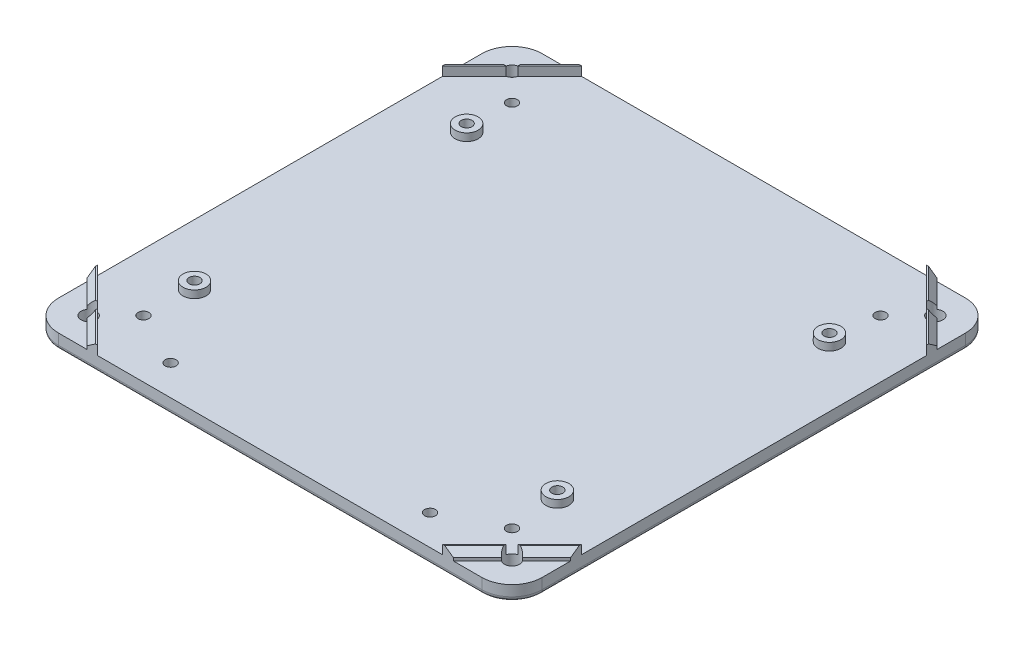
from build123d import *
from build123d.topology import SkipClean

# Parameters (mm, degrees)
SKETCH1_W           = 203.2
SKETCH1_H           = 203.2
BOSS_EXTRUDE1_DEPTH = 6.35
FILLET1_R           = 12.7
SKETCH2_R           = 3.175
CUT_EXTRUDE1_DEPTH  = 288.438345563
FILLET2_R           = 1.905
SKETCH3_R           = 2.286
CUT_EXTRUDE2_DEPTH  = 288.438345563
SKETCH4_R           = 2.286
CUT_EXTRUDE3_DEPTH  = 288.438345563
SKETCH5_R           = 4.826
SKETCH5_R_2         = 2.286
BOSS_EXTRUDE2_DEPTH = 3.175
BOSS_EXTRUDE3_DEPTH = 3.81
CHAMFER1_SIZE       = 2.54


with BuildPart() as part:
    # Sketch1 → Boss-Extrude1 (new body)
    with BuildSketch(Plane(origin=(0, 0, 0), x_dir=(1, 0, 0), z_dir=(0, 1, 0))):
        with Locations((101.6, 101.6)):
            Rectangle(SKETCH1_W, SKETCH1_H)
    extrude(amount=BOSS_EXTRUDE1_DEPTH)

    # Fillet1
    fillet1_edges = [part.edges().sort_by_distance(p)[0] for p in [
        (0, 3.175, -203.2),
        (0, 3.175, 0),
        (203.2, 3.175, 0),
        (203.2, 3.175, -203.2),
    ]]
    fillet(fillet1_edges, radius=FILLET1_R)

    # Sketch2 → Cut-Extrude1 (cut, through all)
    with BuildSketch(Plane.XZ):
        with Locations((12.7, -12.7)):
            Circle(SKETCH2_R)
        with Locations((190.5, -12.7)):
            Circle(SKETCH2_R)
        with Locations((190.5, -190.5)):
            Circle(SKETCH2_R)
        with Locations((12.7, -190.5)):
            Circle(SKETCH2_R)
    extrude(amount=-CUT_EXTRUDE1_DEPTH, mode=Mode.SUBTRACT)

    # Fillet2
    fillet2_edges = [part.edges().sort_by_distance(p)[0] for p in [
        (3.719743879, 0, -3.719743879),
        (101.6, 0, 0),
        (199.480256121, 0, -3.719743879),
        (203.2, 0, -101.6),
        (199.480256121, 0, -199.480256121),
        (101.6, 0, -203.2),
        (3.719743879, 0, -199.480256121),
        (0, 0, -101.6),
        (9.525, 0, -12.7),
        (187.325, 0, -12.7),
        (187.325, 0, -190.5),
        (9.525, 0, -190.5),
    ]]
    fillet(fillet2_edges, radius=FILLET2_R)

    # Sketch3 → Cut-Extrude2 (cut, through all)
    with BuildSketch(Plane(origin=(0, 6.35, 0), x_dir=(1, 0, 0), z_dir=(0, 1, 0))):
        with Locations((24.197781122, 24.197781122)):
            Circle(SKETCH3_R)
        with Locations((179.002218878, 179.002218878)):
            Circle(SKETCH3_R)
        with Locations((179.002218878, 24.197781122)):
            Circle(SKETCH3_R)
        with Locations((24.197781122, 179.002218878)):
            Circle(SKETCH3_R)
    extrude(amount=-CUT_EXTRUDE2_DEPTH, mode=Mode.SUBTRACT)

    # Sketch4 → Cut-Extrude3 (cut, through all)
    with BuildSketch(Plane(origin=(0, 6.35, 0), x_dir=(1, 0, 0), z_dir=(0, 1, 0))):
        with Locations((47.117, 12.7)):
            Circle(SKETCH4_R)
        with Locations((156.083, 12.7)):
            Circle(SKETCH4_R)
    extrude(amount=-CUT_EXTRUDE3_DEPTH, mode=Mode.SUBTRACT)

    # Sketch5 → Boss-Extrude2 (add)
    # profile 1 of 4: a face of its own
    with BuildSketch(Plane(origin=(0, 6.35, 0), x_dir=(1, 0, 0), z_dir=(0, 1, 0))):
        with Locations((25.4, 158.75)):
            Circle(SKETCH5_R)
        with Locations((25.4, 158.75)):
            Circle(SKETCH5_R_2, mode=Mode.SUBTRACT)
    # profile 2 of 4: a face of its own
    with BuildSketch(Plane(origin=(0, 6.35, 0), x_dir=(1, 0, 0), z_dir=(0, 1, 0))):
        with Locations((177.8, 158.75)):
            Circle(SKETCH5_R)
        with Locations((177.8, 158.75)):
            Circle(SKETCH5_R_2, mode=Mode.SUBTRACT)
    # profile 3 of 4: a face of its own
    with BuildSketch(Plane(origin=(0, 6.35, 0), x_dir=(1, 0, 0), z_dir=(0, 1, 0))):
        with Locations((177.8, 44.45)):
            Circle(SKETCH5_R)
        with Locations((177.8, 44.45)):
            Circle(SKETCH5_R_2, mode=Mode.SUBTRACT)
    # profile 4 of 4: a face of its own
    with BuildSketch(Plane(origin=(0, 6.35, 0), x_dir=(1, 0, 0), z_dir=(0, 1, 0))):
        with Locations((25.4, 44.45)):
            Circle(SKETCH5_R)
        with Locations((25.4, 44.45)):
            Circle(SKETCH5_R_2, mode=Mode.SUBTRACT)
    extrude(amount=BOSS_EXTRUDE2_DEPTH)

    # Sketch6 → Boss-Extrude3 (add)
    with SkipClean():  # the faces are left unmerged after this step: merging them gives an invalid solid
        with BuildSketch(Plane(origin=(0, 6.35, 0), x_dir=(1, 0, 0), z_dir=(0, 1, 0))):
            with BuildLine():
                Line((203.2, 29.12872), (189.886429467, 15.815149467))
                ThreePointArc((189.886429467, 15.815149467), (191.679620112, 15.647731567), (193.093253903, 14.531845843))
                Line((193.093253903, 14.531845843), (203.2, 24.638591939))
                Line((203.2, 24.638591939), (203.2, 29.12872))
            make_face()
            with BuildLine():
                Line((178.561408061, 0), (174.07128, 0))
                Line((174.07128, 0), (187.384850533, 13.313570533))
                ThreePointArc((187.384850533, 13.313570533), (187.552268433, 11.520379888), (188.668154157, 10.106746097))
                Line((188.668154157, 10.106746097), (178.561408061, 0))
            make_face()
            with BuildLine():
                Line((13.313570533, 15.815149467), (0, 29.12872))
                Line((0, 29.12872), (0, 24.638591939))
                Line((0, 24.638591939), (10.106746097, 14.531845843))
                ThreePointArc((10.106746097, 14.531845843), (11.520379888, 15.647731567), (13.313570533, 15.815149467))
            make_face()
            with BuildLine():
                Line((24.638591939, 0), (14.531845843, 10.106746097))
                ThreePointArc((14.531845843, 10.106746097), (15.647731567, 11.520379888), (15.815149467, 13.313570533))
                Line((15.815149467, 13.313570533), (29.12872, 0))
                Line((29.12872, 0), (24.638591939, 0))
            make_face()
            with BuildLine():
                Line((15.815149467, 189.886429467), (29.12872, 203.2))
                Line((29.12872, 203.2), (24.638591939, 203.2))
                Line((24.638591939, 203.2), (14.531845843, 193.093253903))
                ThreePointArc((14.531845843, 193.093253903), (15.647731567, 191.679620112), (15.815149467, 189.886429467))
            make_face()
            with BuildLine():
                Line((0, 178.561408061), (10.106746097, 188.668154157))
                ThreePointArc((10.106746097, 188.668154157), (11.520379888, 187.552268433), (13.313570533, 187.384850533))
                Line((13.313570533, 187.384850533), (0, 174.07128))
                Line((0, 174.07128), (0, 178.561408061))
            make_face()
            with BuildLine():
                Line((189.886429467, 187.384850533), (203.2, 174.07128))
                Line((203.2, 174.07128), (203.2, 178.561408061))
                Line((203.2, 178.561408061), (193.093253903, 188.668154157))
                ThreePointArc((193.093253903, 188.668154157), (191.679620112, 187.552268433), (189.886429467, 187.384850533))
            make_face()
            with BuildLine():
                Line((178.561408061, 203.2), (188.668154157, 193.093253903))
                ThreePointArc((188.668154157, 193.093253903), (187.552268433, 191.679620112), (187.384850533, 189.886429467))
                Line((187.384850533, 189.886429467), (174.07128, 203.2))
                Line((174.07128, 203.2), (178.561408061, 203.2))
            make_face()
        extrude(amount=BOSS_EXTRUDE3_DEPTH)

    # Chamfer1
    chamfer1_edges = [part.edges().sort_by_distance(p)[0] for p in [
        (198.146626952, 10.16, -19.585218891),
        (183.614781109, 10.16, -5.053373048),
        (198.146626952, 10.16, -183.614781109),
        (183.614781109, 10.16, -198.146626952),
        (19.585218891, 10.16, -198.146626952),
        (5.053373048, 10.16, -183.614781109),
        (19.585218891, 10.16, -5.053373048),
        (5.053373048, 10.16, -19.585218891),
    ]]
    chamfer(chamfer1_edges, length=CHAMFER1_SIZE)


solid = part.part
